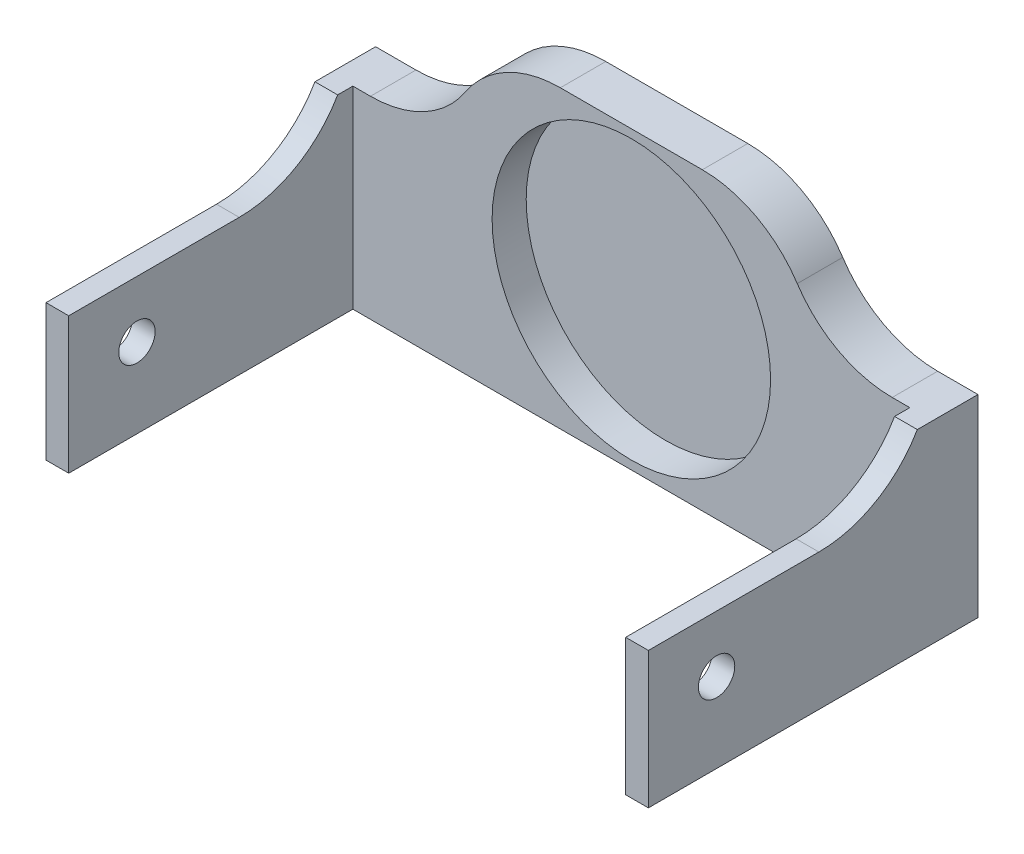
from build123d import *

# Parameters (mm, degrees)
SKETCH1_W           = 53
SKETCH1_H           = 26
BOSS_EXTRUDE2_DEPTH = 4
SKETCH3_R           = 12.25
CUT_EXTRUDE2_DEPTH  = 3
CUT_EXTRUDE3_REACH  = 52.374
SKETCH4_W           = 13.5
SKETCH4_H           = 9
FILLET1_R           = 10
FILLET2_R           = 10
SKETCH5_W           = 2
SKETCH5_H           = 12
BOSS_EXTRUDE3_DEPTH = 25
SKETCH6_R           = 1.6
CUT_EXTRUDE4_DEPTH  = 64.562322282
FILLET3_R           = 10


with BuildPart() as part:
    # Sketch1 → Boss-Extrude2 (new body)
    with BuildSketch(Plane.XY):
        with Locations((19.666835682, -6.752691308)):
            Rectangle(SKETCH1_W, SKETCH1_H)
    extrude(amount=BOSS_EXTRUDE2_DEPTH)

    # Sketch3 → Cut-Extrude2 (cut)
    with BuildSketch(Plane.XY.offset(4)):
        with Locations((19.666835682, -6.752691308)):
            Circle(SKETCH3_R)
    extrude(amount=-CUT_EXTRUDE2_DEPTH, mode=Mode.SUBTRACT)

    # Sketch4 → Cut-Extrude3 (cut, up to next)
    with BuildSketch(Plane.XY.offset(4), mode=Mode.PRIVATE) as cut_extrude3_sk1:
        with Locations((-0.083164318, 1.747308692)):
            Rectangle(SKETCH4_W, SKETCH4_H)
    cut_extrude3_tool1 = extrude(cut_extrude3_sk1.sketch, amount=-CUT_EXTRUDE3_REACH, mode=Mode.PRIVATE) & part.part
    # Sketch4 → Cut-Extrude3 (cut, up to next)
    with BuildSketch(Plane.XY.offset(4), mode=Mode.PRIVATE) as cut_extrude3_sk2:
        with Locations((39.416835682, 1.747308692)):
            Rectangle(SKETCH4_W, SKETCH4_H)
    cut_extrude3_tool2 = extrude(cut_extrude3_sk2.sketch, amount=-CUT_EXTRUDE3_REACH, mode=Mode.PRIVATE) & part.part
    add(cut_extrude3_tool1.solids().sort_by_distance((-0.083164, 1.747309, 4))[0], mode=Mode.SUBTRACT)
    add(cut_extrude3_tool2.solids().sort_by_distance((39.416836, 1.747309, 4))[0], mode=Mode.SUBTRACT)

    # Fillet1
    # the kernel refuses this fillet: 10 mm, written as the material it adds along each edge
    with BuildSketch(Plane(origin=(32.666835682, -2.752691308, 4), x_dir=(0, 1, 0), z_dir=(0, 0, -1))) as fillet1_piece_1:
        with BuildLine():
            CenterArc((10, 9.949874371), FILLET1_R, 180, 84.260829523)
            Line((0, 9.949874371), (-0.2, 9.949874371))
            Line((-0.2, 9.949874371), (-0.2, 0))
            Line((-0.2, 0), (0, -0.2))
            ThreePointArc((0, -0.2), (4.5, -0.2), (8.98, -0.198997487))
            Line((8.98, -0.198997487), (9, 0))
        make_face()
    extrude(amount=4)
    with BuildSketch(Plane(origin=(6.666835682, -2.752691308, 4), x_dir=(0, 1, 0), z_dir=(0, 0, -1))) as fillet1_piece_2:
        with BuildLine():
            CenterArc((10, -9.949874371), FILLET1_R, 95.739170477, 84.260829523)
            Line((0, -9.949874371), (-0.2, -9.949874371))
            Line((-0.2, -9.949874371), (-0.2, 0))
            Line((-0.2, 0), (0, 0.2))
            ThreePointArc((0, 0.2), (4.5, 0.2), (8.98, 0.198997487))
            Line((8.98, 0.198997487), (9, 0))
        make_face()
    extrude(amount=4)

    # Fillet2
    fillet2_edges = [part.edges().sort_by_distance(p)[0] for p in [
        (6.666835682, 6.247308692, 2),
        (32.666835682, 6.247308692, 2),
    ]]
    fillet(fillet2_edges, radius=FILLET2_R)

    # Sketch5 → Boss-Extrude3 (add)
    with BuildSketch(Plane.XY.offset(4)):
        with Locations((-5.833164318, -13.752691308)):
            Rectangle(SKETCH5_W, SKETCH5_H)
        with Locations((45.166835682, -13.752691308)):
            Rectangle(SKETCH5_W, SKETCH5_H)
    extrude(amount=BOSS_EXTRUDE3_DEPTH)

    # Sketch6 → Cut-Extrude4 (cut, through all)
    with BuildSketch(Plane.ZY.offset(6.833164318)):
        with Locations(Location((23, -12.752691308, 0), (0, 0, 270))):
            Circle(SKETCH6_R)
    extrude(amount=-CUT_EXTRUDE4_DEPTH, mode=Mode.SUBTRACT)

    # Fillet3
    # the kernel refuses this fillet: 10 mm, written as the material it adds along each edge
    with BuildSketch(Plane(origin=(44.166835682, -7.752691308, 4), x_dir=(0, 1, 0), z_dir=(1, 0, 0))) as fillet3_piece_1_section:
        with BuildLine():
            CenterArc((FILLET3_R, FILLET3_R), FILLET3_R, 180, 90)
            Line((0, FILLET3_R), (0, 0))
            Line((0, 0), (FILLET3_R, 0))
        make_face()
    fillet3_piece_1 = extrude(amount=2, mode=Mode.PRIVATE)
    fillet3_piece_1 = split(fillet3_piece_1, bisect_by=Plane(origin=(45.166835682, -2.752691308, 6.440248494), z_dir=(0, -1, 0)), keep=Keep.TOP, mode=Mode.PRIVATE)
    add(fillet3_piece_1)
    with BuildSketch(Plane(origin=(-6.833164318, -7.752691308, 4), x_dir=(0, 1, 0), z_dir=(1, 0, 0))) as fillet3_piece_2_section:
        with BuildLine():
            CenterArc((FILLET3_R, FILLET3_R), FILLET3_R, 180, 90)
            Line((0, FILLET3_R), (0, 0))
            Line((0, 0), (FILLET3_R, 0))
        make_face()
    fillet3_piece_2 = extrude(amount=2, mode=Mode.PRIVATE)
    fillet3_piece_2 = split(fillet3_piece_2, bisect_by=Plane(origin=(-5.833164318, -2.752691308, 6.440248494), z_dir=(0, -1, 0)), keep=Keep.TOP, mode=Mode.PRIVATE)
    add(fillet3_piece_2)


solid = part.part
